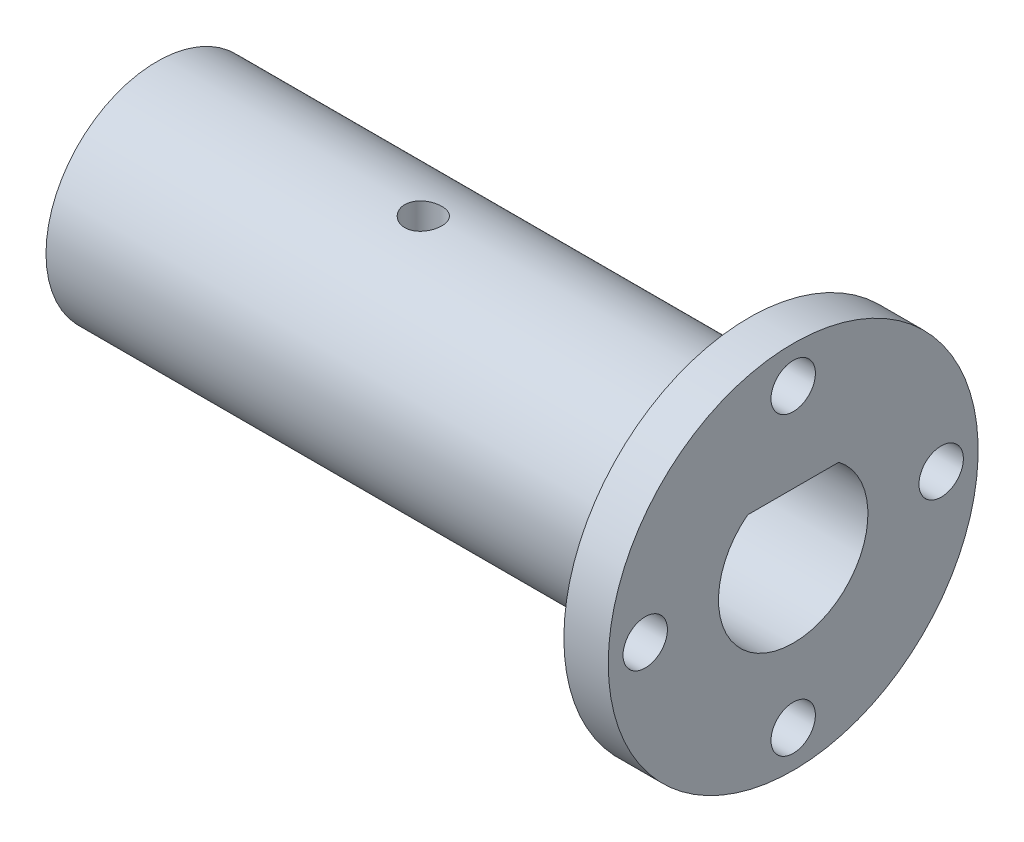
from build123d import *

# Parameters (mm, degrees)
SKETCH_1_W            = 3
SKETCH_1_H            = 12.5
SKETCH_2_R            = 7.5
EXTRUDE_1_DEPTH       = 40
CUT_EXTRUDE_1_DEPTH   = 47.491934784
HOLE_WIZARD_3_0_3_3_D = 3
SKETCH_9_R            = 1.25
CUT_EXTRUDE_2_DEPTH   = 10


with BuildPart() as part:
    # 草图1 → 旋转1 (revolve)
    with BuildSketch(Plane(origin=(0, 0, 0), x_dir=(-1, 0, 0), z_dir=(0, 0, -1))):
        with Locations((-41.5, 6.25)):
            Rectangle(SKETCH_1_W, SKETCH_1_H)
    revolve(axis=Axis((43, 0, 0), (-1, 0, 0)))

    # 草图2 → 凸台-拉伸1 (add)
    with BuildSketch(Plane.ZY.offset(-40)):
        Circle(SKETCH_2_R)
    extrude(amount=EXTRUDE_1_DEPTH)

    # 草图3 → 切除-拉伸1 (cut, through all)
    with BuildSketch(Plane.ZY):
        with BuildLine():
            Line((3.082612528, 4), (-3.082612528, 4))
            ThreePointArc((-3.082612528, 4), (0, -5.05), (3.082612528, 4))
        make_face()
    extrude(amount=-CUT_EXTRUDE_1_DEPTH, mode=Mode.SUBTRACT)

    # Ø3.0 (3) 直径孔3 (through all)
    with Locations(Plane.ZY.offset(-40)):
        with Locations((10, 0), (0, -10), (-10, 0), (0, 10)):
            Hole(HOLE_WIZARD_3_0_3_3_D / 2)

    # 草图9 → 切除-拉伸2 (cut)
    with BuildSketch(Plane.XZ.offset(-4)):
        with Locations((18, 0)):
            Circle(SKETCH_9_R)
    extrude(amount=-CUT_EXTRUDE_2_DEPTH, mode=Mode.SUBTRACT)


solid = part.part
